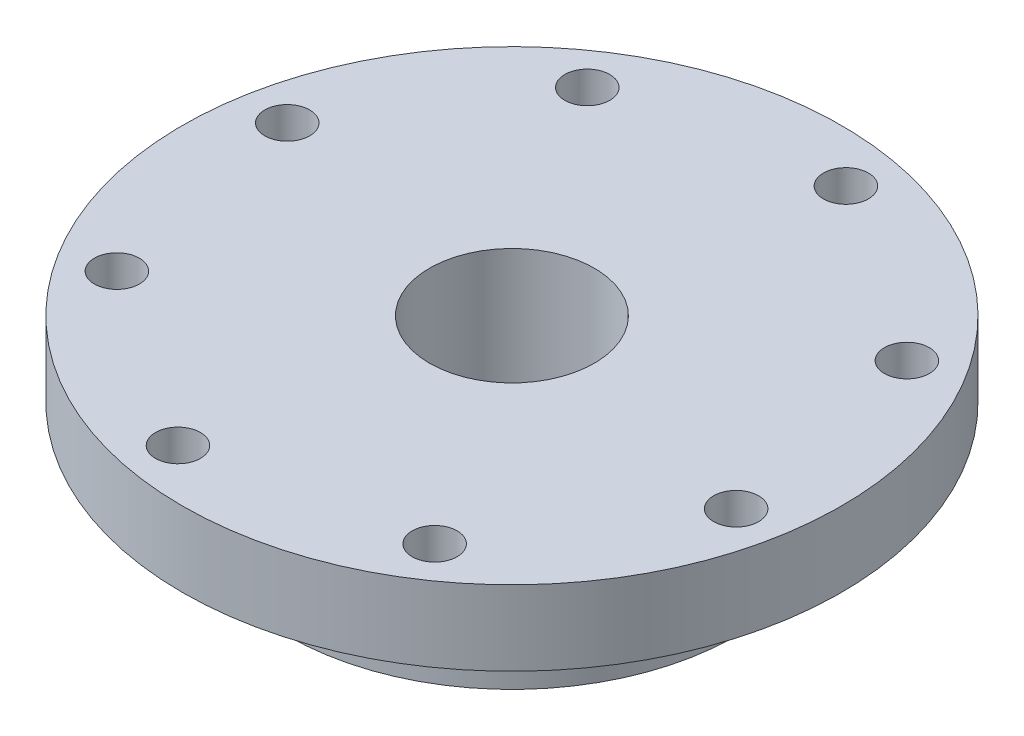
from build123d import *

# Parameters (mm, degrees)
DIAM_TRE_DU_PER_AGE_3_0_3_1_D = 3


with BuildPart() as part:
    # Esquisse1 → Révolution1 (revolve)
    with BuildSketch(Plane.XY):
        Polygon((-5.5, 0), (-22, 0), (-22, -5), (-15, -5), (-15, -11), (-11, -11), (-11, -8.5), (-5.5, -8.5), align=None)
    revolve(axis=Axis((0, 41.470120614, 0), (0, -1, 0)))

    # Diamètre du perçage Ø3.0 (3)1 (through all)
    with Locations(Plane(origin=(3.647024388, 0, -18.646694429), x_dir=(0, 0, 1), z_dir=(0, 1, 0))):
        with Locations((0, 0), (8.05893299, 12.12951857), (22.320944817, 14.994324385), (2.934102993, -14.329461861), (14.999670041, -22.293718817), (29.25306283, -19.411064141), (37.293388858, -7.294048776), (34.410734182, 6.959344013)):
            Hole(DIAM_TRE_DU_PER_AGE_3_0_3_1_D / 2)


solid = part.part
